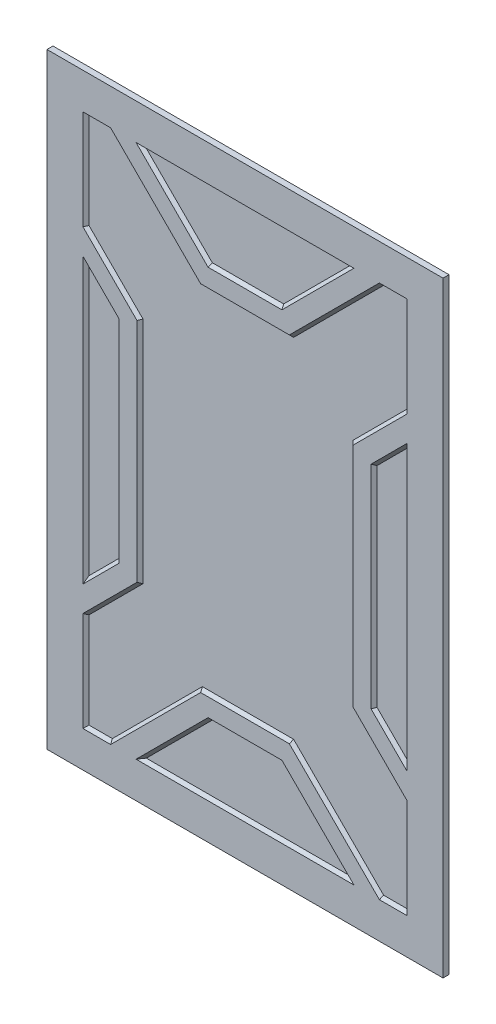
from build123d import *

# Parameters (mm, degrees)
ESQUISSE1_W             = 660
ESQUISSE1_H             = 1010
BOSS_EXTRU_1_DEPTH      = 10
ENL_V_MAT_EXTRU_1_DEPTH = 5
CHANFREIN1_SIZE         = 5


with BuildPart() as part:
    # Esquisse1 → Boss.-Extru.1 (new body)
    with BuildSketch(Plane.XY):
        with Locations((330, 505)):
            Rectangle(ESQUISSE1_W, ESQUISSE1_H)
    extrude(amount=BOSS_EXTRU_1_DEPTH)

    # Esquisse2 → Enlèv. mat.-Extru.1 (cut)
    with BuildSketch(Plane.XY.offset(10)):
        Polygon((120, 328.492424049), (120, 681.507575951), (60, 741.507575951), (60, 268.492424049), align=None)
        Polygon((268.492424049, 830), (391.507575951, 830), (511.507575951, 950), (148.492424049, 950), align=None)
        Polygon((60, 950), (60, 783.933982822), (150, 693.933982822), (150, 316.066017178), (60, 226.066017178), (60, 60), (106.066017178, 60), (256.066017178, 210), (403.933982822, 210), (553.933982822, 60), (600, 60), (600, 226.066017178), (510, 316.066017178), (510, 693.933982822), (600, 783.933982822), (600, 950), (553.933982822, 950), (403.933982822, 800), (256.066017178, 800), (106.066017178, 950), align=None)
        Polygon((540, 328.492424049), (540, 681.507575951), (600, 741.507575951), (600, 268.492424049), align=None)
        Polygon((511.507575951, 60), (148.492424049, 60), (268.492424049, 180), (391.507575951, 180), align=None)
    extrude(amount=-ENL_V_MAT_EXTRU_1_DEPTH, mode=Mode.SUBTRACT)

    # Chanfrein1
    chanfrein1_edges = [part.edges().sort_by_distance(p)[0] for p in [
        (330, 60, 5),
        (208.492424049, 120, 5),
        (330, 180, 5),
        (451.507575951, 120, 5),
        (60, 505, 5),
        (90, 711.507575951, 5),
        (120, 505, 5),
        (90, 298.492424049, 5),
        (600, 505, 5),
        (570, 298.492424049, 5),
        (540, 505, 5),
        (570, 711.507575951, 5),
        (181.066017178, 875, 5),
        (330, 800, 5),
        (478.933982822, 875, 5),
        (576.966991411, 950, 5),
        (600, 866.966991411, 5),
        (555, 738.933982822, 5),
        (510, 505, 5),
        (555, 271.066017178, 5),
        (600, 143.033008589, 5),
        (576.966991411, 60, 5),
        (478.933982822, 135, 5),
        (330, 210, 5),
        (181.066017178, 135, 5),
        (83.033008589, 60, 5),
        (60, 143.033008589, 5),
        (105, 271.066017178, 5),
        (150, 505, 5),
        (105, 738.933982822, 5),
        (60, 866.966991411, 5),
        (83.033008589, 950, 5),
        (330, 950, 5),
        (451.507575951, 890, 5),
        (330, 830, 5),
        (208.492424049, 890, 5),
    ]]
    chamfer(chanfrein1_edges, length=CHANFREIN1_SIZE - 0.0001)  # a hair under: the kernel refuses the full size


solid = part.part
